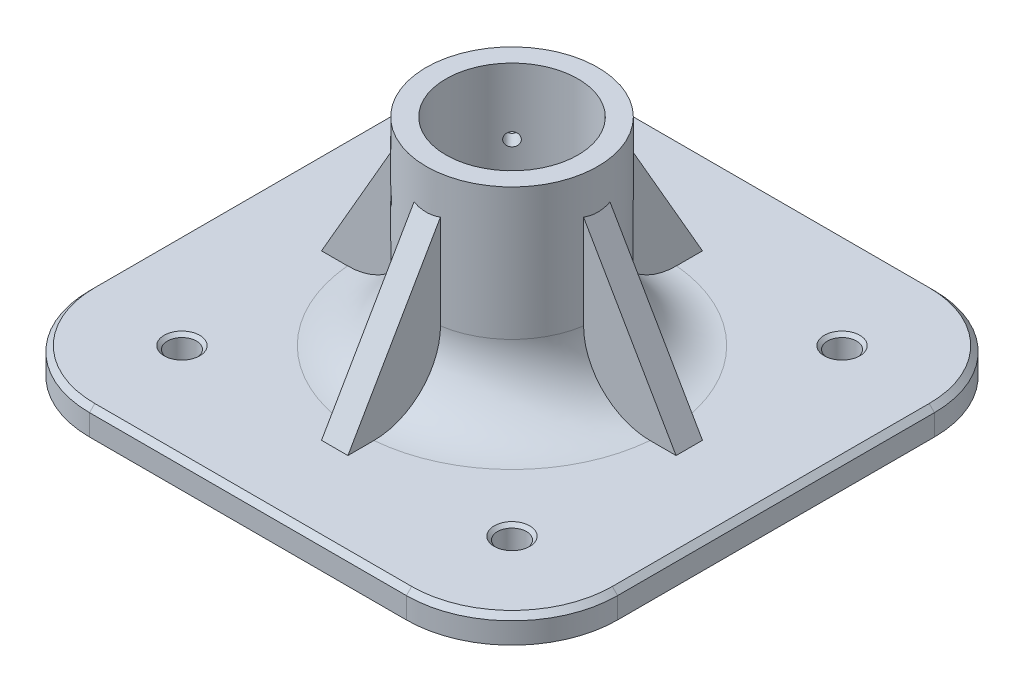
from build123d import *

# Parameters (mm, degrees)
SKETCH2_W                       = 200
SKETCH2_H                       = 200
BOSS_EXTRUDE1_DEPTH             = 10
SKETCH3_R                       = 32.5
SKETCH3_R_2                     = 25
BOSS_EXTRUDE2_DEPTH             = 75
M10_CLEARANCE_HOLE1_D           = 11
M10_CLEARANCE_HOLE1_CSINK_D     = 13.5
M10_CLEARANCE_HOLE1_CSINK_ANGLE = 90
CIRPATTERN1_COUNT               = 2
CIRPATTERN1_ANGLE               = 90
RIB5_REACH                      = 167
SKETCH13_WALL_W                 = 401.282032406
SKETCH13_WALL_H                 = 10
CIRPATTERN2_COUNT               = 4
FILLET1_R                       = 25
FILLET2_R                       = 40
CHAMFER1_SIZE                   = 2


# Read off the part's stored shape, not the designer's step: M6x1.0 Tapped Hole1
with BuildPart() as part:
    # Sketch2 → Boss-Extrude1 (new body)
    with BuildSketch(Plane(origin=(0, 0, 0), x_dir=(1, 0, 0), z_dir=(0, 1, 0))):
        Rectangle(SKETCH2_W, SKETCH2_H)
    extrude(amount=BOSS_EXTRUDE1_DEPTH)

    # Sketch3 → Boss-Extrude2 (add)
    with BuildSketch(Plane(origin=(0, 10, 0), x_dir=(1, 0, 0), z_dir=(0, 1, 0))):
        with Locations(Location((0, 0, 0), (0, 0, 90))):
            Circle(SKETCH3_R)
        with Locations(Location((0, 0, 0), (0, 0, 270))):
            Circle(SKETCH3_R_2, mode=Mode.SUBTRACT)
    extrude(amount=BOSS_EXTRUDE2_DEPTH)

    # M10 Clearance Hole1 (through all)
    with Locations(Plane(origin=(0, 10, 0), x_dir=(1, 0, 0), z_dir=(0, 1, 0))):
        with Locations((-62.5, -62.5), (62.5, 62.5), (-62.5, 62.5), (62.5, -62.5)):
            CounterSinkHole(M10_CLEARANCE_HOLE1_D / 2, M10_CLEARANCE_HOLE1_CSINK_D / 2, counter_sink_angle=M10_CLEARANCE_HOLE1_CSINK_ANGLE)

    # M6x1.0 Tapped Hole1 outline → M6x1.0 Tapped Hole1 (revolve, cut)
    with BuildSketch(Plane(origin=(0, 60, 0), x_dir=(0.707106781186546, 0, 0.707106781186549), z_dir=(0, 1, 0))):
        Polygon((0, -32.500112934), (3.750112934, -32.500112934), (2.5, -31.25), (2.5, -24.874618187), (0, -24.874618187), align=None)
    m6x1_0_tapped_hole1 = revolve(axis=Axis((0, 60, 0), (0.707106781186549, 0, -0.707106781186546)), mode=Mode.SUBTRACT)

    # CirPattern1: M6x1.0 Tapped Hole1 ×2 about axis
    cirpattern1_axis = Axis((0, 85, 0), (0, -1, 0))
    for i in range(1, CIRPATTERN1_COUNT):
        add(m6x1_0_tapped_hole1.rotate(cirpattern1_axis, i * CIRPATTERN1_ANGLE / (CIRPATTERN1_COUNT - 1)), mode=Mode.SUBTRACT)

    # Sketch13 wall → Rib5 (add, up to next)
    with BuildSketch(Plane(origin=(-49.820508076, 40, 0), x_dir=(-0.499999999996, -0.866025403787, 0), z_dir=(0.866025403787, -0.499999999996, 0)), mode=Mode.PRIVATE) as rib5_sk1:
        Rectangle(SKETCH13_WALL_W, SKETCH13_WALL_H)
    rib5_tool1 = extrude(rib5_sk1.sketch, amount=RIB5_REACH, mode=Mode.PRIVATE) - part.part
    rib5 = rib5_tool1.solids().sort_by_distance((-49.820508076, 40, 0))[0]
    add(rib5)

    # CirPattern2: Rib5 ×4 about axis
    cirpattern2_axis = Axis((0, 0, 0), (0, 1, 0))
    for i in range(1, CIRPATTERN2_COUNT):
        add(rib5.rotate(cirpattern2_axis, i * 360 / CIRPATTERN2_COUNT))

    # Fillet1
    fillet1_edges = [part.edges().sort_by_distance(p)[0] for p in [
        (-22.980970389, 10, -22.980970389),
        (22.980970389, 10, -22.980970389),
        (22.980970389, 10, 22.980970389),
        (-22.980970389, 10, 22.980970389),
    ]]
    fillet(fillet1_edges, radius=FILLET1_R)

    # Fillet2
    fillet2_edges = [part.edges().sort_by_distance(p)[0] for p in [
        (100, 5, 100),
        (-100, 5, 100),
        (-100, 5, -100),
        (100, 5, -100),
    ]]
    fillet(fillet2_edges, radius=FILLET2_R)

    # Chamfer1
    chamfer1_edges = [part.edges().sort_by_distance(p)[0] for p in [
        (0, 10, 100),
        (-100, 10, 0),
        (0, 10, -100),
        (100, 10, 0),
        (88.284271247, 10, 88.284271247),
        (88.284271247, 10, -88.284271247),
        (-88.284271247, 10, -88.284271247),
        (-88.284271247, 10, 88.284271247),
    ]]
    chamfer(chamfer1_edges, length=CHAMFER1_SIZE)


solid = part.part
